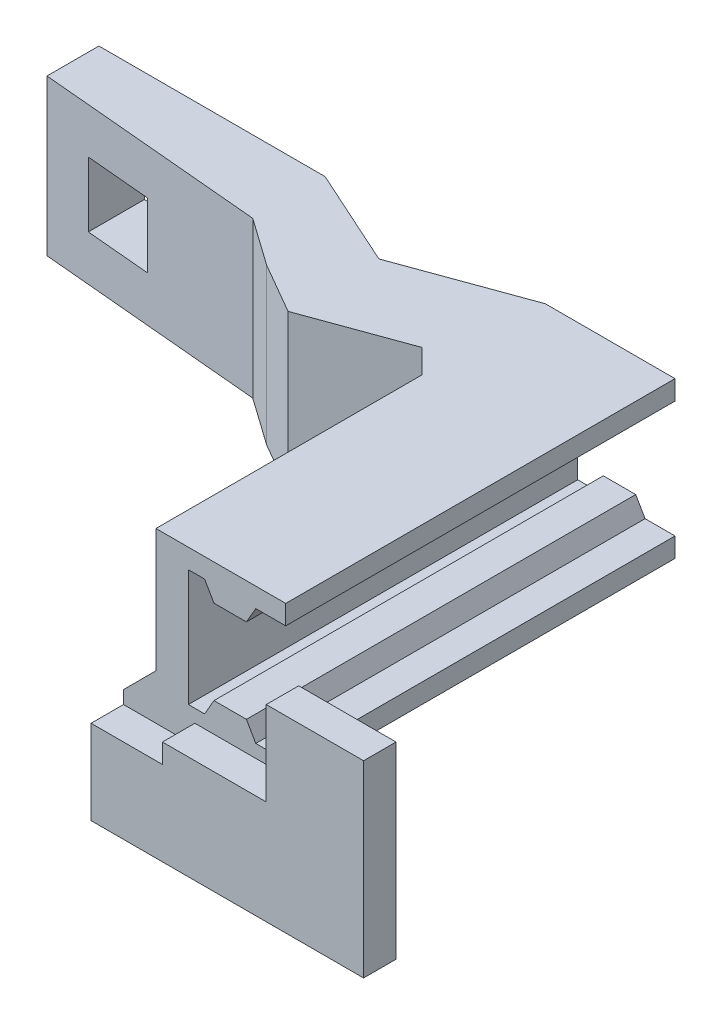
from build123d import *

# Parameters (mm, degrees)
BOSS_EXTRUDE1_DEPTH = 30
SKETCH2_W           = 11
SKETCH2_H           = 25
BOSS_EXTRUDE2_DEPTH = 15
CHAMFER1_SIZE       = 5
SKETCH3_W           = 42
SKETCH3_H           = 13
BOSS_EXTRUDE3_DEPTH = 5
BOSS_EXTRUDE4_DEPTH = 5
BOSS_EXTRUDE5_DEPTH = 24
CHAMFER2_SIZE       = 5
CHAMFER2_SIZE2      = 3.901030044
BOSS_EXTRUDE6_DEPTH = 24
SKETCH7_W           = 10
SKETCH7_H           = 10
CUT_EXTRUDE1_DEPTH  = 10


with BuildPart() as part:
    # Sketch1 → Boss-Extrude1 (new, symmetric)
    with BuildSketch(Plane.XY.offset(-109.087000354)):
        Polygon((-916.669839571, 150.370500968), (-916.669839571, 153.370500968), (-936.669839571, 153.370500968), (-936.669839571, 129.370500968), (-916.669839571, 129.370500968), (-916.669839571, 132.370500968), (-921.283088225, 132.370500968), (-922.726463898, 134.870500968), (-927.726463898, 134.870500968), (-929.169839571, 132.370500968), (-931.669839571, 132.370500968), (-931.669839571, 150.370500968), (-929.169839571, 150.370500968), (-927.726463898, 147.870500968), (-922.726463898, 147.870500968), (-921.283088225, 150.370500968), align=None)
    extrude(amount=BOSS_EXTRUDE1_DEPTH, both=True)

    # Sketch2 → Boss-Extrude2 (add)
    with BuildSketch(Plane.XZ.offset(-129.370500968)):
        with Locations((-936.169839571, -91.587000354)):
            Rectangle(SKETCH2_W, SKETCH2_H)
    extrude(amount=BOSS_EXTRUDE2_DEPTH)

    # Chamfer1
    chamfer1_edges = [part.edges().sort_by_distance(p)[0] for p in [
        (-936.669839571, 129.370500968, -91.587000354),
        (-930.669839571, 129.370500968, -91.587000354),
    ]]
    chamfer(chamfer1_edges, length=CHAMFER1_SIZE - 0.0001)  # a hair under: the kernel refuses the full size

    # Sketch3 → Boss-Extrude3 (add)
    with BuildSketch(Plane.XY.offset(-79.087000354)):
        with Locations((-920.669839571, 120.870500968)):
            Rectangle(SKETCH3_W, SKETCH3_H)
    extrude(amount=BOSS_EXTRUDE3_DEPTH)

    # Sketch4 → Boss-Extrude4 (add)
    with BuildSketch(Plane.XY.offset(-74.087000354)):
        Polygon((-899.669839571, 127.370500968), (-899.669839571, 143.370500968), (-914.669839571, 143.370500968), (-914.669839571, 130.370500968), (-930.669839571, 130.370500968), (-930.669839571, 127.370500968), align=None)
    extrude(amount=-BOSS_EXTRUDE4_DEPTH)

    # Sketch5 → Boss-Extrude5 (add)
    with BuildSketch(Plane(origin=(0, 153.370500968, 0), x_dir=(1, 0, 0), z_dir=(0, 1, 0))):
        Polygon((-936.669839571, 139.087000354), (-936.669839571, 125.087000354), (-955.463691986, 118.246597487), (-955.463691986, 132.246597487), align=None)
    extrude(amount=-BOSS_EXTRUDE5_DEPTH)

    # Chamfer2
    chamfer2_edges = [part.edges().sort_by_distance(p)[0] for p in [
        (-936.669839571, 141.370500968, -125.087000354),
    ]]
    chamfer2_side = [part.faces().sort_by_distance(p)[0] for p in [
        (-936.669839571, 142.583452416, -103.427623846),
    ]]
    chamfer(chamfer2_edges, length=CHAMFER2_SIZE, length2=CHAMFER2_SIZE2, reference=chamfer2_side[0])

    # Sketch6 → Boss-Extrude6 (add)
    with BuildSketch(Plane(origin=(0, 153.370500968, 0), x_dir=(1, 0, 0), z_dir=(0, 1, 0))):
        Polygon((-955.463691986, 132.246597487), (-970.605038874, 139.087000354), (-1005.463691986, 139.087000354), (-1005.463691986, 131.087000354), (-970.605038874, 127.94465995), (-963.25792062, 122.746597487), (-955.463691986, 118.246597487), align=None)
    extrude(amount=-BOSS_EXTRUDE6_DEPTH)

    # Sketch7 → Cut-Extrude1 (cut)
    with BuildSketch(Plane(origin=(0, 0, -139.087000354), x_dir=(-1, 0, 0), z_dir=(0, 0, -1))):
        with Locations((993.463691986, 141.370500968)):
            Rectangle(SKETCH7_W, SKETCH7_H)
    extrude(amount=-CUT_EXTRUDE1_DEPTH, mode=Mode.SUBTRACT)


solid = part.part
